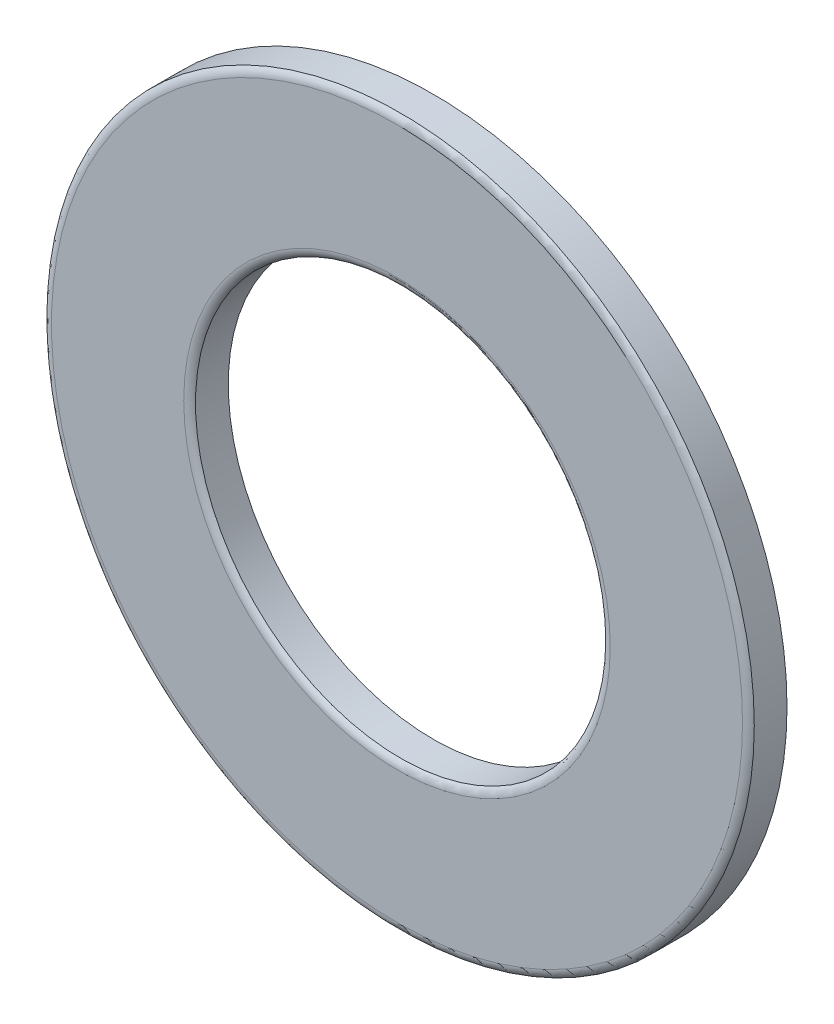
from build123d import *
from OCP.BRepFilletAPI import BRepFilletAPI_MakeChamfer

# Parameters (mm, degrees)
BOSS_EXTRUDE1_START = -1.143
SKETCH3_R           = 22.225
SKETCH3_R_2         = 12.8905
BOSS_EXTRUDE1_DEPTH = 2.286
CHAMFER1_SIZE       = 0.2286
CHAMFER1_SIZE2      = 0.131982272
FILLET1_R           = 0.6858


with BuildPart() as part:
    # Sketch3 → Boss-Extrude1 (new body)
    with BuildSketch(Plane.XY.offset(BOSS_EXTRUDE1_START)):
        Circle(SKETCH3_R)
        Circle(SKETCH3_R_2, mode=Mode.SUBTRACT)
    extrude(amount=BOSS_EXTRUDE1_DEPTH)

    # Chamfer1: one chamfer whose edges measure the first distance from different faces: ONE call of the kernel's chamfer builder (chamfer() names one face for all edges)
    chamfer1_edges_1 = [part.edges().sort_by_distance(p)[0] for p in [
        (-22.225, 0, 1.143),
    ]]
    chamfer1_side_1 = [part.faces().sort_by_distance(p)[0] for p in [
        (-22.225, 0, 0),
    ]]
    chamfer1_edges_2 = [part.edges().sort_by_distance(p)[0] for p in [
        (-12.8905, 0, 1.143),
    ]]
    chamfer1_side_2 = [part.faces().sort_by_distance(p)[0] for p in [
        (-12.8905, 0, 0),
    ]]
    chamfer1 = BRepFilletAPI_MakeChamfer(part.part.solid().wrapped)
    for e in chamfer1_edges_1:
        chamfer1.Add(CHAMFER1_SIZE, CHAMFER1_SIZE2, e.wrapped, chamfer1_side_1[0].wrapped)  # the first distance lies on this face
    for e in chamfer1_edges_2:
        chamfer1.Add(CHAMFER1_SIZE, CHAMFER1_SIZE2, e.wrapped, chamfer1_side_2[0].wrapped)  # the first distance lies on this face
    add(Compound.cast(chamfer1.Shape()), mode=Mode.REPLACE)

    # Fillet1
    # the kernel refuses this fillet: 0.6858 mm, written as the material it takes off along each edge
    with BuildSketch(Plane(origin=(0, 0, 1.143), x_dir=(1, 0, 0), z_dir=(0, -1, 0))) as fillet1_piece_1:
        with BuildLine():
            CenterArc((21.71383486, -0.6858), FILLET1_R, 41.810314896, 48.189685104)
            Line((21.71383486, 0), (21.71383486, 0.013716))
            Line((21.71383486, 0.013716), (22.093017728, 0.013716))
            Line((22.093017728, 0.013716), (22.104896133, 0.006858))
            ThreePointArc((22.104896133, 0.006858), (22.170887269, -0.107442), (22.235223303, -0.219456))
            Line((22.235223303, -0.219456), (22.225, -0.2286))
        make_face()
    revolve(axis=Axis((0, 0, 1.143), (0, 0, 1)), mode=Mode.SUBTRACT)
    with BuildSketch(Plane(origin=(0, 0, 1.143), x_dir=(1, 0, 0), z_dir=(0, -1, 0))) as fillet1_piece_2:
        with BuildLine():
            CenterArc((13.40166514, -0.6858), FILLET1_R, 90, 48.189685104)
            Line((12.8905, -0.2286), (12.880276697, -0.219456))
            ThreePointArc((12.880276697, -0.219456), (12.944612731, -0.107442), (13.010603867, 0.006858))
            Line((13.010603867, 0.006858), (13.022482272, 0.013716))
            Line((13.022482272, 0.013716), (13.40166514, 0.013716))
            Line((13.40166514, 0.013716), (13.40166514, 0))
        make_face()
    revolve(axis=Axis((0, 0, 1.143), (0, 0, 1)), mode=Mode.SUBTRACT)


solid = part.part
